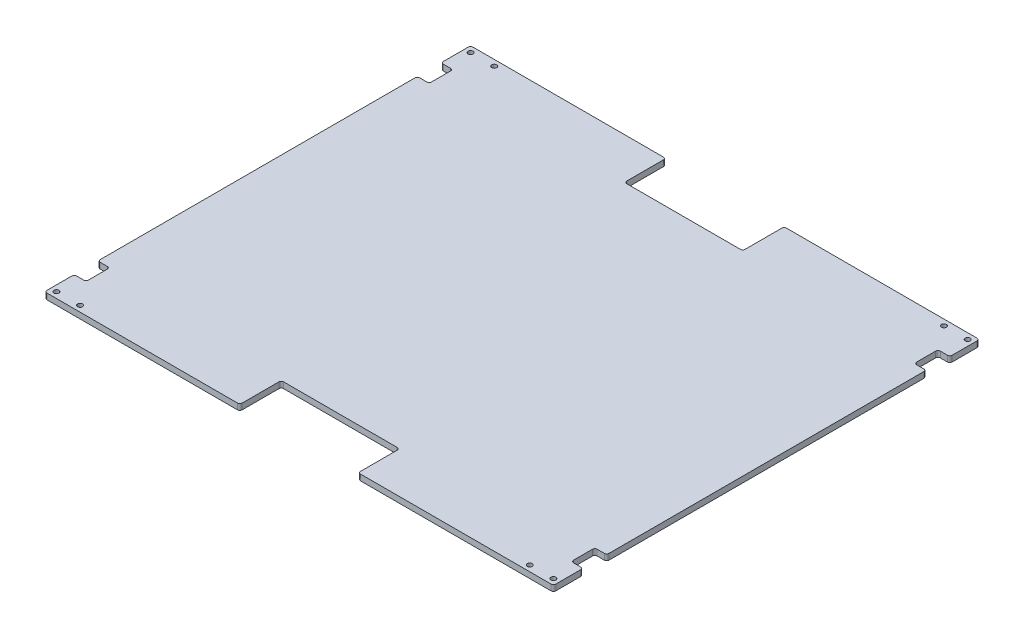
from build123d import *

# Parameters (mm, degrees)
SKETCH1_R           = 2.667
BOSS_EXTRUDE1_DEPTH = 6.35


with BuildPart() as part:
    # Sketch1 → Boss-Extrude1 (new body)
    with BuildSketch(Plane(origin=(0, 0, 0), x_dir=(1, 0, 0), z_dir=(0, 1, 0))):
        with BuildLine():
            Line((-273.05, 226.06), (-273.05, 199.39))
            ThreePointArc((-273.05, 199.39), (-272.306051224, 197.593948776), (-270.51, 196.85))
            Line((-270.51, 196.85), (-262.89, 196.85))
            ThreePointArc((-262.89, 196.85), (-261.093948776, 196.106051224), (-260.35, 194.31))
            Line((-260.35, 194.31), (-260.35, 173.99))
            ThreePointArc((-260.35, 173.99), (-261.093948776, 172.193948776), (-262.89, 171.45))
            Line((-262.89, 171.45), (-270.51, 171.45))
            ThreePointArc((-270.51, 171.45), (-272.306051224, 170.706051224), (-273.05, 168.91))
            Line((-273.05, 168.91), (-273.05, -168.91))
            ThreePointArc((-273.05, -168.91), (-272.306051224, -170.706051224), (-270.51, -171.45))
            Line((-270.51, -171.45), (-262.89, -171.45))
            ThreePointArc((-262.89, -171.45), (-261.093948776, -172.193948776), (-260.35, -173.99))
            Line((-260.35, -173.99), (-260.35, -194.31))
            ThreePointArc((-260.35, -194.31), (-261.093948776, -196.106051224), (-262.89, -196.85))
            Line((-262.89, -196.85), (-270.51, -196.85))
            ThreePointArc((-270.51, -196.85), (-272.306051224, -197.593948776), (-273.05, -199.39))
            Line((-273.05, -199.39), (-273.05, -226.06))
            ThreePointArc((-273.05, -226.06), (-272.306051224, -227.856051224), (-270.51, -228.6))
            Line((-270.51, -228.6), (-66.04, -228.6))
            ThreePointArc((-66.04, -228.6), (-64.243948776, -227.856051224), (-63.5, -226.06))
            Line((-63.5, -226.06), (-63.5, -186.69))
            ThreePointArc((-63.5, -186.69), (-62.756051224, -184.893948776), (-60.96, -184.15))
            Line((-60.96, -184.15), (60.96, -184.15))
            ThreePointArc((60.96, -184.15), (62.756051224, -184.893948776), (63.5, -186.69))
            Line((63.5, -186.69), (63.5, -226.06))
            ThreePointArc((63.5, -226.06), (64.243948776, -227.856051224), (66.04, -228.6))
            Line((66.04, -228.6), (270.51, -228.6))
            ThreePointArc((270.51, -228.6), (272.306051224, -227.856051224), (273.05, -226.06))
            Line((273.05, -226.06), (273.05, -199.39))
            ThreePointArc((273.05, -199.39), (272.306051224, -197.593948776), (270.51, -196.85))
            Line((270.51, -196.85), (262.89, -196.85))
            ThreePointArc((262.89, -196.85), (261.093948776, -196.106051224), (260.35, -194.31))
            Line((260.35, -194.31), (260.35, -173.99))
            ThreePointArc((260.35, -173.99), (261.093948776, -172.193948776), (262.89, -171.45))
            Line((262.89, -171.45), (270.51, -171.45))
            ThreePointArc((270.51, -171.45), (272.306051224, -170.706051224), (273.05, -168.91))
            Line((273.05, -168.91), (273.05, 168.91))
            ThreePointArc((273.05, 168.91), (272.306051224, 170.706051224), (270.51, 171.45))
            Line((270.51, 171.45), (262.89, 171.45))
            ThreePointArc((262.89, 171.45), (261.093948776, 172.193948776), (260.35, 173.99))
            Line((260.35, 173.99), (260.35, 194.31))
            ThreePointArc((260.35, 194.31), (261.093948776, 196.106051224), (262.89, 196.85))
            Line((262.89, 196.85), (270.51, 196.85))
            ThreePointArc((270.51, 196.85), (272.306051224, 197.593948776), (273.05, 199.39))
            Line((273.05, 199.39), (273.05, 226.06))
            ThreePointArc((273.05, 226.06), (272.306051224, 227.856051224), (270.51, 228.6))
            Line((270.51, 228.6), (66.04, 228.6))
            ThreePointArc((66.04, 228.6), (64.243948776, 227.856051224), (63.5, 226.06))
            Line((63.5, 226.06), (63.5, 186.69))
            ThreePointArc((63.5, 186.69), (62.756051224, 184.893948776), (60.96, 184.15))
            Line((60.96, 184.15), (-60.96, 184.15))
            ThreePointArc((-60.96, 184.15), (-62.756051224, 184.893948776), (-63.5, 186.69))
            Line((-63.5, 186.69), (-63.5, 226.06))
            ThreePointArc((-63.5, 226.06), (-64.243948776, 227.856051224), (-66.04, 228.6))
            Line((-66.04, 228.6), (-270.51, 228.6))
            ThreePointArc((-270.51, 228.6), (-272.306051224, 227.856051224), (-273.05, 226.06))
        make_face()
        with Locations((-266.7, 222.25)):
            Circle(SKETCH1_R, mode=Mode.SUBTRACT)
        with Locations((266.7, 222.25)):
            Circle(SKETCH1_R, mode=Mode.SUBTRACT)
        with Locations((-241.3, 222.25)):
            Circle(SKETCH1_R, mode=Mode.SUBTRACT)
        with Locations((241.3, 222.25)):
            Circle(SKETCH1_R, mode=Mode.SUBTRACT)
        with Locations((-266.7, -222.25)):
            Circle(SKETCH1_R, mode=Mode.SUBTRACT)
        with Locations((266.7, -222.25)):
            Circle(SKETCH1_R, mode=Mode.SUBTRACT)
        with Locations((-241.3, -222.25)):
            Circle(SKETCH1_R, mode=Mode.SUBTRACT)
        with Locations((241.3, -222.25)):
            Circle(SKETCH1_R, mode=Mode.SUBTRACT)
    extrude(amount=BOSS_EXTRUDE1_DEPTH)


solid = part.part
